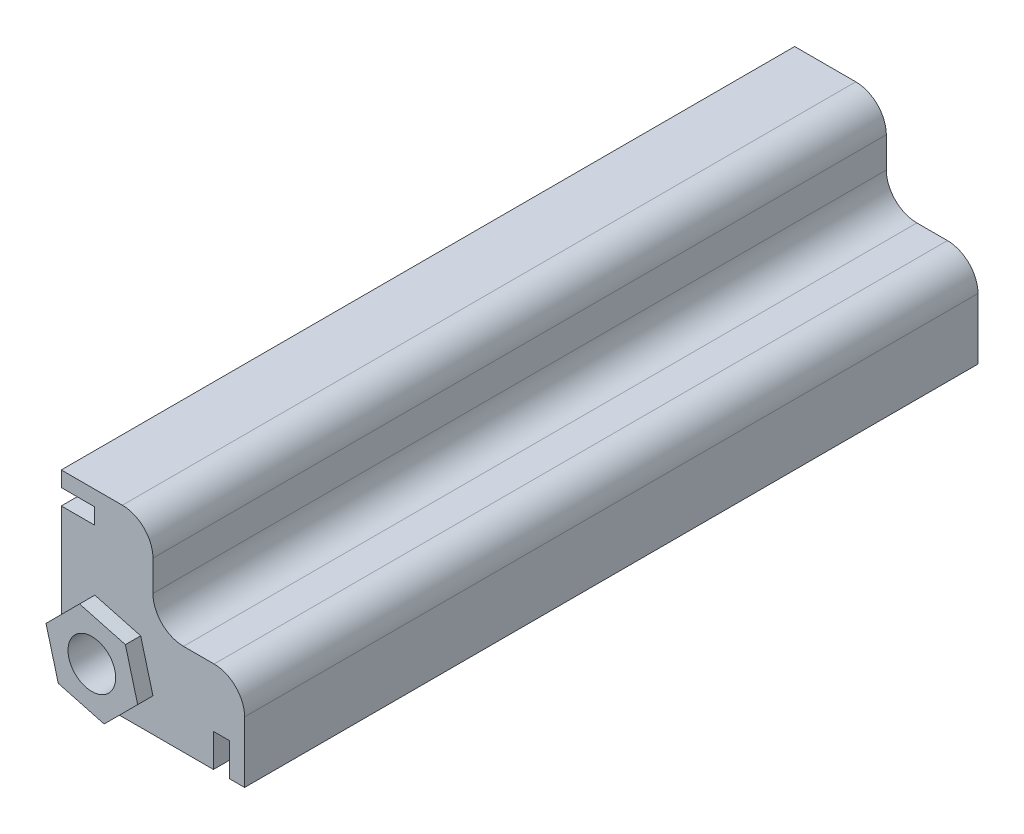
from build123d import *

# Parameters (mm, degrees)
BOSS_EXTRUDE1_DEPTH = 152.4
SKETCH2_W           = 6.858
SKETCH2_H           = 3.302
SKETCH2_W_2         = 3.302
SKETCH2_H_2         = 6.858
CUT_EXTRUDE1_DEPTH  = 162.644610179
BOSS_EXTRUDE2_DEPTH = 3.175
FILLET1_R           = 6.35
SKETCH4_R           = 4.953
CUT_EXTRUDE2_DEPTH  = 165.641430463


with BuildPart() as part:
    # Sketch1 → Boss-Extrude1 (new body)
    with BuildSketch(Plane.XY):
        Polygon((0, 0), (0, 38.1), (19.05, 38.1), (19.05, 19.05), (38.1, 19.05), (38.1, 0), align=None)
    extrude(amount=BOSS_EXTRUDE1_DEPTH)

    # Sketch2 → Cut-Extrude1 (cut, through all)
    with BuildSketch(Plane.XY.offset(152.4)):
        with Locations((3.429, 33.274)):
            Rectangle(SKETCH2_W, SKETCH2_H)
        with Locations((33.274, 3.429)):
            Rectangle(SKETCH2_W_2, SKETCH2_H_2)
    extrude(amount=-CUT_EXTRUDE1_DEPTH, mode=Mode.SUBTRACT)

    # Sketch3 → Boss-Extrude2 (add)
    with BuildSketch(Plane.XY.offset(152.4)):
        Polygon((16.497783942, 16.497783942), (6.972783942, 19.05), (0, 12.077216058), (2.552216058, 2.552216058), (12.077216058, 0), (19.05, 6.972783942), align=None)
    extrude(amount=BOSS_EXTRUDE2_DEPTH)

    # Fillet1
    fillet1_edges = [part.edges().sort_by_distance(p)[0] for p in [
        (19.05, 19.05, 76.2),
        (38.1, 19.05, 76.2),
        (19.05, 38.1, 76.2),
    ]]
    fillet(fillet1_edges, radius=FILLET1_R)

    # Sketch4 → Cut-Extrude2 (cut, through all)
    with BuildSketch(Plane.XY.offset(155.575)):
        with Locations((9.525, 9.525)):
            Circle(SKETCH4_R)
    extrude(amount=-CUT_EXTRUDE2_DEPTH, mode=Mode.SUBTRACT)


solid = part.part
